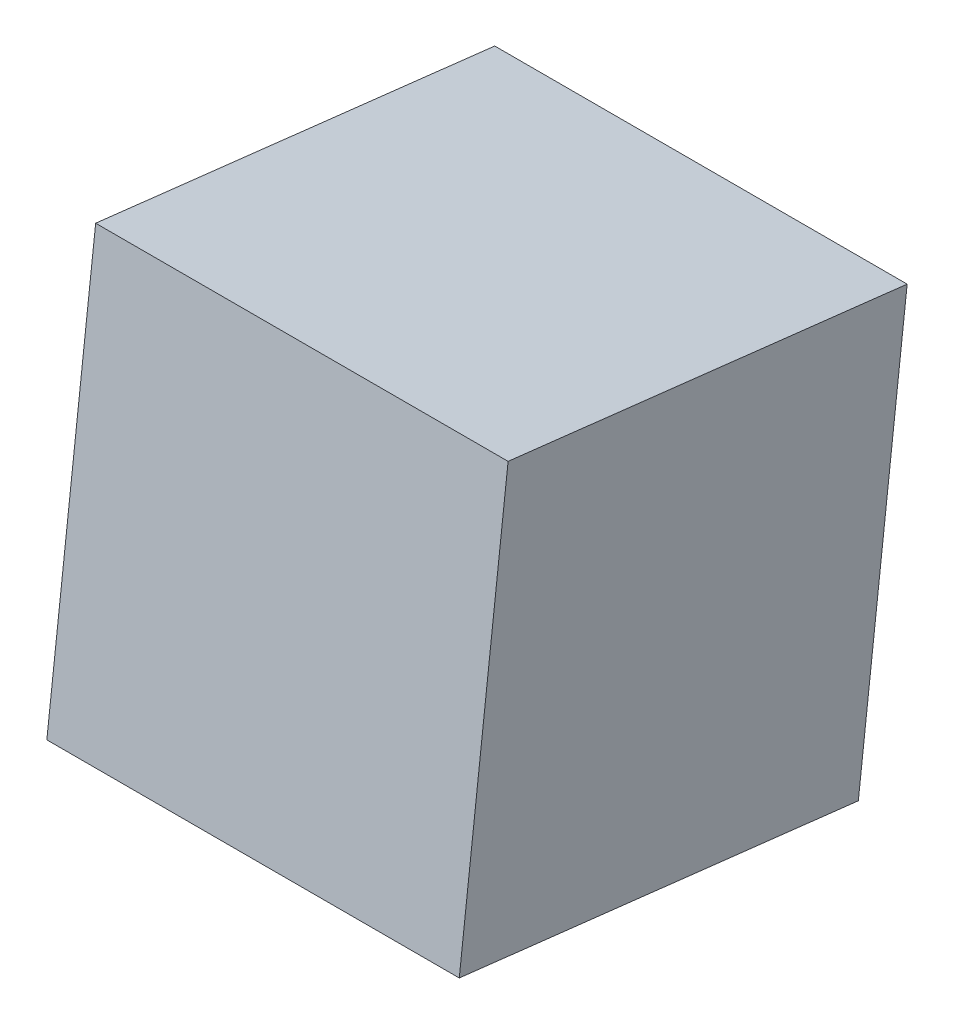
from build123d import *

# Parameters (mm, degrees)
SKETCH1_W           = 154
SKETCH1_H           = 150
BOSS_EXTRUDE1_DEPTH = 159


with BuildPart() as part:
    # Sketch1 → Boss-Extrude1 (new body)
    with BuildSketch(Plane(origin=(0, 358.879876801, -41.422455829), x_dir=(1, 0, 0), z_dir=(-6.837425950214788e-15, 0.9934047622419533, -0.1146602736566085))):
        with Locations((-135, 211.357042425)):
            Rectangle(SKETCH1_W, SKETCH1_H)
    extrude(amount=BOSS_EXTRUDE1_DEPTH)


solid = part.part
